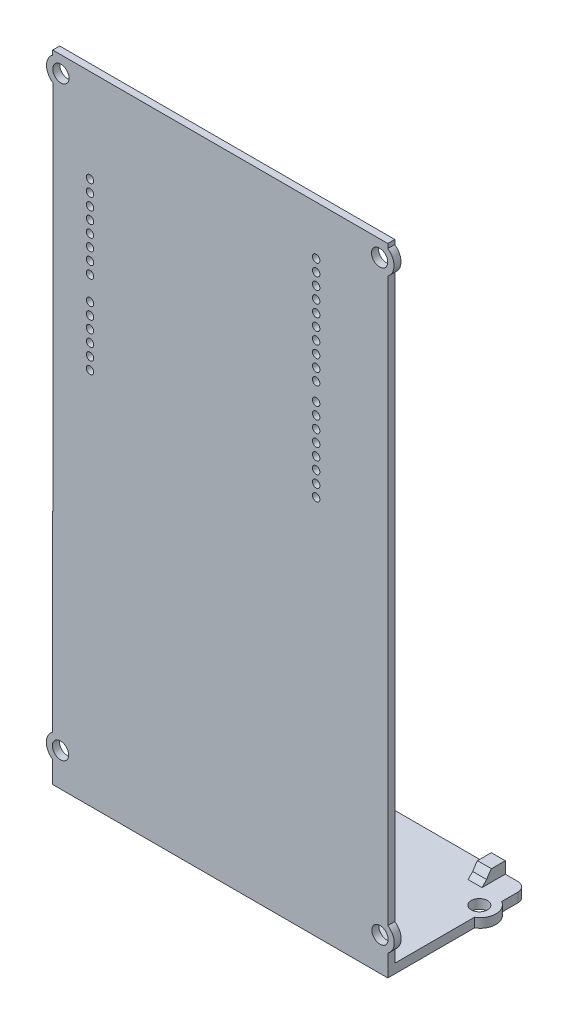
from build123d import *

# Parameters (mm, degrees)
SKETCH1_R                = 1.75
BOSS_EXTRUDE1_DEPTH      = 1.5
BOSS_EXTRUDE2_DEPTH      = 72
BOSS_EXTRUDE3_DEPTH      = 1.5
BOSS_EXTRUDE3_DEPTH_BACK = 1.5
BOSS_EXTRUDE4_DEPTH      = 2
SKETCH5_R                = 1.75
CUT_EXTRUDE1_DEPTH       = 2
CUT_EXTRUDE2_DEPTH       = 148.332054879
CUT_EXTRUDE2_DEPTH_BACK  = 148.332054879
SKETCH6_W                = 72
SKETCH6_H                = 11.553195909
BOSS_EXTRUDE6_START      = -2
SKETCH7_W                = 3
SKETCH7_H                = 4
BOSS_EXTRUDE6_DEPTH      = 2.5
FILLET1_R                = 2
CHAMFER1_SIZE            = 1
FILLET2_R                = 8
SKETCH8_W                = 35
SKETCH8_H                = 19.946804091
CUT_EXTRUDE3_DEPTH       = 22.4262221
SKETCH10_R               = 0.8
CUT_EXTRUDE4_DEPTH       = 1.5


with BuildPart() as part:
    # Sketch1 → Boss-Extrude1 (new body)
    with BuildSketch(Plane.XY):
        with BuildLine():
            Line((-31.5, -134.5), (31.5, -134.5))
            Line((31.5, -134.5), (36, -134.5))
            Line((36, -134.5), (36, -132.049019419))
            ThreePointArc((36, -132.049019419), (37.374296294, -129.5), (36, -126.950980581))
            Line((36, -126.950980581), (36, -6.049019419))
            ThreePointArc((36, -6.049019419), (37.33874188, -3.5), (36, -0.950980581))
            Line((36, -0.950980581), (36, 0))
            Line((36, 0), (-36, 0))
            Line((-36, 0), (-36, -0.950980581))
            ThreePointArc((-36, -0.950980581), (-37.339851511, -3.504206195), (-35.994020506, -6.054285021))
            Line((-35.994020506, -6.054285021), (-36, -126.950980581))
            ThreePointArc((-36, -126.950980581), (-37.376731289, -129.5), (-36, -132.049019419))
            Line((-36, -132.049019419), (-36, -134.5))
            Line((-36, -134.5), (-31.5, -134.5))
        make_face()
        with Locations((-34.328609587, -129.5)):
            Circle(SKETCH1_R, mode=Mode.SUBTRACT)
        with Locations((34.323211043, -129.5)):
            Circle(SKETCH1_R, mode=Mode.SUBTRACT)
        with Locations((34.242652207, -3.5)):
            Circle(SKETCH1_R, mode=Mode.SUBTRACT)
        with Locations((-34.244120111, -3.500578956)):
            Circle(SKETCH1_R, mode=Mode.SUBTRACT)
    extrude(amount=BOSS_EXTRUDE1_DEPTH)

    # Sketch2 → Boss-Extrude2 (add)
    with BuildSketch(Plane.ZY.offset(36)):
        Polygon((1.5, -134.5), (1.5, -136.7), (-40, -136.7), (-40, -134.7), (0, -134.7), (0, -134.5), (0, -132.049019419), (1.5, -132.049019419), align=None)
    extrude(amount=-BOSS_EXTRUDE2_DEPTH)

    # Sketch3 → Boss-Extrude3 (add, two sides: drawn at the far end of the back side and taken through both)
    with BuildSketch(Plane(origin=(0, 0, 0), x_dir=(0, 0, -1), z_dir=(1, 0, 0)).offset(-BOSS_EXTRUDE3_DEPTH_BACK)):
        Polygon((0, -119.7), (15, -134.7), (0, -134.7), align=None)
    extrude(amount=BOSS_EXTRUDE3_DEPTH + BOSS_EXTRUDE3_DEPTH_BACK)

    # Sketch4 → Boss-Extrude4 (add)
    with BuildSketch(Plane.XZ.offset(136.7)):
        with BuildLine():
            Line((-36, -17.152805247), (-36, -22.963011674))
            ThreePointArc((-36, -22.963011674), (-37.650416645, -20.05790846), (-36, -17.152805247))
        make_face()
        with BuildLine():
            Line((36, -17.152805247), (36, -22.963011674))
            ThreePointArc((36, -22.963011674), (37.68082264, -20.05790846), (36, -17.152805247))
        make_face()
    extrude(amount=-BOSS_EXTRUDE4_DEPTH)

    # Sketch5 → Cut-Extrude1 (cut)
    with BuildSketch(Plane.XZ.offset(136.7)):
        with Locations(Location((-34.253947115, -19.946804091, 0), (0, 0, 270))):
            Circle(SKETCH5_R)
        with Locations(Location((34.288977705, -19.889159472, 0), (0, 0, 270))):
            Circle(SKETCH5_R)
    extrude(amount=-CUT_EXTRUDE1_DEPTH, mode=Mode.SUBTRACT)

    # Sketch6 → Cut-Extrude2 (cut, two sides: drawn at the far end of the back side and taken through both)
    with BuildSketch(Plane.XZ.offset(136.7).offset(-CUT_EXTRUDE2_DEPTH_BACK)):
        with Locations((0, -34.223402046)):
            Rectangle(SKETCH6_W, SKETCH6_H)
    extrude(amount=CUT_EXTRUDE2_DEPTH + CUT_EXTRUDE2_DEPTH_BACK, mode=Mode.SUBTRACT)

    # Sketch7 → Boss-Extrude6 (add)
    with BuildSketch(Plane.XZ.offset(136.7).offset(BOSS_EXTRUDE6_START)):
        with Locations((-29.8, -26.446804091)):
            Rectangle(SKETCH7_W, SKETCH7_H)
        with Locations((29.8, -26.446804091)):
            Rectangle(SKETCH7_W, SKETCH7_H)
    extrude(amount=-BOSS_EXTRUDE6_DEPTH)

    # Fillet1
    fillet1_edges = [part.edges().sort_by_distance(p)[0] for p in [
        (36, -135.7, -28.446804091),
        (-36, -135.7, -28.446804091),
    ]]
    fillet(fillet1_edges, radius=FILLET1_R)

    # Chamfer1
    chamfer1_edges = [part.edges().sort_by_distance(p)[0] for p in [
        (-29.8, -134.7, -24.446804091),
        (-29.8, -132.2, -24.446804091),
        (29.8, -134.7, -24.446804091),
        (29.8, -132.2, -24.446804091),
    ]]
    chamfer(chamfer1_edges, length=CHAMFER1_SIZE)

    # Fillet2
    # the kernel refuses this fillet: 8 mm, written as the material it takes off along each edge
    with BuildSketch(Plane(origin=(-23.303909917, -133.2, -24.446804091), x_dir=(0, -1.0, -1.118394266079786e-11), z_dir=(-1, 0, 0))) as fillet2_piece_1:
        with BuildLine():
            CenterArc((4.243746579, -7.06996192), FILLET2_R, 117.902496562, 17.097503438)
            Line((-1.413107671, -1.413107671), (0, 0))
            Line((0, 0), (0.5, 0))
        make_face()
    extrude(amount=12.992180166, mode=Mode.SUBTRACT)
    with BuildSketch(Plane(origin=(23.303909917, -133.2, -24.446804091), x_dir=(0, 0.7071067811865476, -0.7071067811865476), z_dir=(1, 0, 0))) as fillet2_piece_2:
        with BuildLine():
            CenterArc((1.998436033, -8), FILLET2_R, 90, 17.097503438)
            Line((-0.353553391, -0.353553391), (0, 0))
            Line((0, 0), (1.998436033, 0))
        make_face()
    extrude(amount=12.992180166, mode=Mode.SUBTRACT)

    # Sketch8 → Cut-Extrude3 (cut)
    with BuildSketch(Plane.XZ.offset(136.7)):
        with Locations((-13.5, -15.473402046)):
            Rectangle(SKETCH8_W, SKETCH8_H)
    extrude(amount=-CUT_EXTRUDE3_DEPTH, mode=Mode.SUBTRACT)

    # Sketch10 → Cut-Extrude4 (cut)
    with BuildSketch(Plane.XY.offset(1.5)):
        with Locations((-27.994710245, -20)):
            Circle(SKETCH10_R)
        with Locations((-27.994710245, -22.54)):
            Circle(SKETCH10_R)
        with Locations((-27.994710245, -25.08)):
            Circle(SKETCH10_R)
        with Locations((-27.994710245, -27.62)):
            Circle(SKETCH10_R)
        with Locations((-27.994710245, -30.16)):
            Circle(SKETCH10_R)
        with Locations((-27.994710245, -32.7)):
            Circle(SKETCH10_R)
        with Locations((-27.994710245, -35.24)):
            Circle(SKETCH10_R)
        with Locations((-27.994710245, -37.78)):
            Circle(SKETCH10_R)
        with Locations((20.605289755, -10.5)):
            Circle(SKETCH10_R)
        with Locations((-27.994710245, -42.86)):
            Circle(SKETCH10_R)
        with Locations((-27.994710245, -45.4)):
            Circle(SKETCH10_R)
        with Locations((-27.994710245, -47.94)):
            Circle(SKETCH10_R)
        with Locations((-27.994710245, -50.48)):
            Circle(SKETCH10_R)
        with Locations((-27.994710245, -53.02)):
            Circle(SKETCH10_R)
        with Locations((-27.994710245, -55.56)):
            Circle(SKETCH10_R)
        with Locations((20.605289755, -13.04)):
            Circle(SKETCH10_R)
        with Locations((20.605289755, -15.58)):
            Circle(SKETCH10_R)
        with Locations((20.605289755, -18.12)):
            Circle(SKETCH10_R)
        with Locations((20.605289755, -20.66)):
            Circle(SKETCH10_R)
        with Locations((20.605289755, -23.2)):
            Circle(SKETCH10_R)
        with Locations((20.605289755, -25.74)):
            Circle(SKETCH10_R)
        with Locations((20.605289755, -28.28)):
            Circle(SKETCH10_R)
        with Locations((20.605289755, -30.82)):
            Circle(SKETCH10_R)
        with Locations((20.605289755, -33.36)):
            Circle(SKETCH10_R)
        with Locations((20.605289755, -37.16)):
            Circle(SKETCH10_R)
        with Locations((20.605289755, -39.7)):
            Circle(SKETCH10_R)
        with Locations((20.605289755, -42.24)):
            Circle(SKETCH10_R)
        with Locations((20.605289755, -44.78)):
            Circle(SKETCH10_R)
        with Locations((20.605289755, -47.32)):
            Circle(SKETCH10_R)
        with Locations((20.605289755, -49.86)):
            Circle(SKETCH10_R)
        with Locations((20.605289755, -52.4)):
            Circle(SKETCH10_R)
        with Locations((20.605289755, -54.94)):
            Circle(SKETCH10_R)
    extrude(amount=-CUT_EXTRUDE4_DEPTH, mode=Mode.SUBTRACT)


solid = part.part
